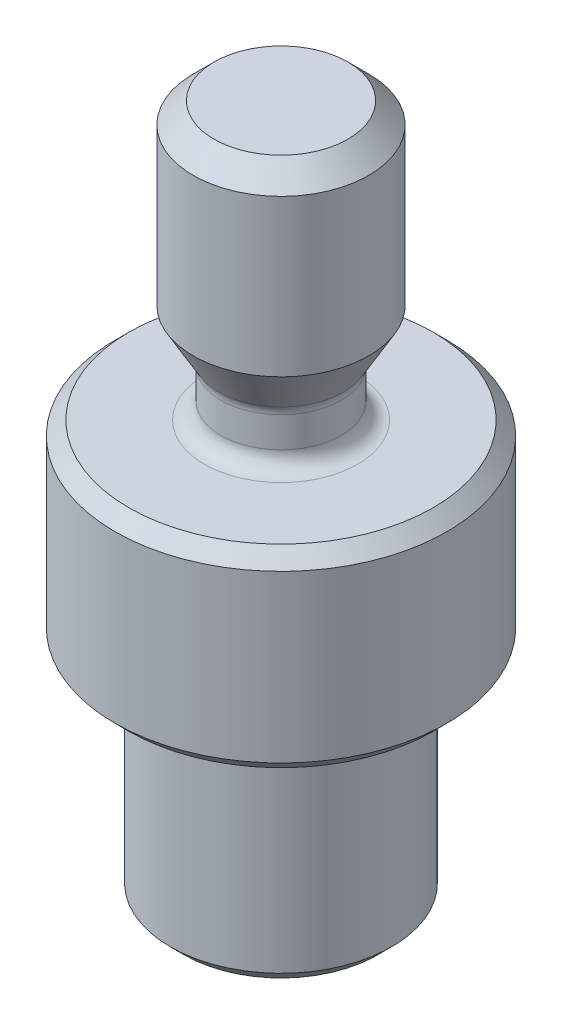
from build123d import *

# Parameters (mm, degrees)
CHAMFER1_SIZE = 0.5


# Read off the part's stored shape, not the designer's step: 1/4-20 Machine Threads Stud1
with BuildPart() as part:
    # Sketch1 → Revolve1 (revolve)
    with BuildSketch(Plane.XY, mode=Mode.PRIVATE) as revolve1_sk:
        Polygon((0, 0), (0, 25), (-4, 25), (-4, 15), (-6, 15), (-6, 8), (-4, 8), (-4, 0), align=None)
    revolve(revolve1_sk.sketch.rotate(Axis((0, 0, 0), (0, 1, 0)), 270), axis=Axis((0, 0, 0), (0, 1, 0)))

    # 1/4-20 Machine Threads Stud1 outline → 1/4-20 Machine Threads Stud1 (revolve, cut)
    with BuildSketch(Plane.XY):
        with BuildLine():
            Line((2.774999784, 15), (4, 15))
            Line((4, 15), (4, 25))
            Line((4, 25), (2.41935, 25))
            Line((2.41935, 25), (3.175, 24.24435))
            Line((3.175, 24.24435), (3.175, 18.592822263))
            Line((3.175, 18.592822263), (2.255384261, 17.00000108))
            ThreePointArc((2.255384261, 17.00000108), (2.195443975, 16.855292429), (2.17499946, 16.700000918))
            Line((2.17499946, 16.700000918), (2.17499946, 15.600000324))
            ThreePointArc((2.17499946, 15.600000324), (2.350735486, 15.175736026), (2.774999784, 15))
        make_face()
    revolve(axis=Axis((0, 0, 0), (0, 1, 0)), mode=Mode.SUBTRACT)

    # Chamfer1
    chamfer1_edges = [part.edges().sort_by_distance(p)[0] for p in [
        (0, 0, 4),
        (0, 8, 6),
        (0, 15, 6),
    ]]
    chamfer(chamfer1_edges, length=CHAMFER1_SIZE)


solid = part.part
